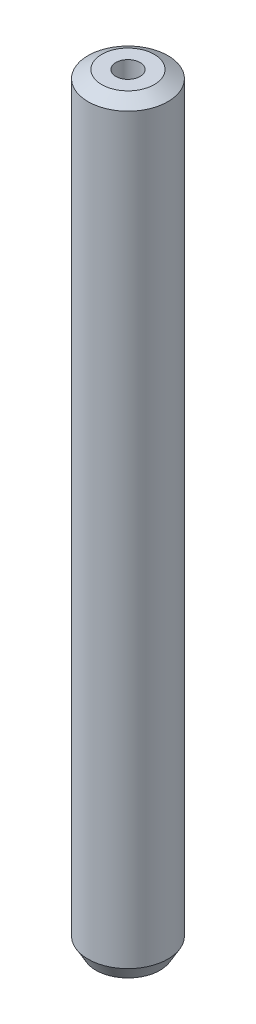
from build123d import *
from OCP.BRepFilletAPI import BRepFilletAPI_MakeChamfer

# Parameters (mm, degrees)
SKETCH1_R           = 27.5
BOSS_EXTRUDE1_DEPTH = 526.149621223
SKETCH2_R           = 8.356343826
CUT_EXTRUDE1_DEPTH  = 528.584992122
CHAMFER1_SIZE       = 5.446793177
CHAMFER1_SIZE2      = 9.434122521


with BuildPart() as part:
    # Sketch1 → Boss-Extrude1 (new body)
    with BuildSketch(Plane(origin=(0, 0, 0), x_dir=(1, 0, 0), z_dir=(0, 1, 0))):
        Circle(SKETCH1_R)
    extrude(amount=BOSS_EXTRUDE1_DEPTH)

    # Sketch2 → Cut-Extrude1 (cut, through all)
    with BuildSketch(Plane(origin=(0, 0, 0), x_dir=(1, 0, 0), z_dir=(0, 1, 0))):
        Circle(SKETCH2_R)
    extrude(amount=CUT_EXTRUDE1_DEPTH, mode=Mode.SUBTRACT)

    # Chamfer1: one chamfer whose edges measure the first distance from different faces: ONE call of the kernel's chamfer builder (chamfer() names one face for all edges)
    chamfer1_edges_1 = [part.edges().sort_by_distance(p)[0] for p in [
        (-27.5, 526.149621223, 0),
    ]]
    chamfer1_side_1 = [part.faces().sort_by_distance(p)[0] for p in [
        (-27.5, 263.074810611, 0),
    ]]
    chamfer1_edges_2 = [part.edges().sort_by_distance(p)[0] for p in [
        (-27.5, 0, 0),
    ]]
    chamfer1_side_2 = [part.faces().sort_by_distance(p)[0] for p in [
        (-26.722182541, 0, 0),
    ]]
    chamfer1 = BRepFilletAPI_MakeChamfer(part.part.solid().wrapped)
    for e in chamfer1_edges_1:
        chamfer1.Add(CHAMFER1_SIZE, CHAMFER1_SIZE2, e.wrapped, chamfer1_side_1[0].wrapped)  # the first distance lies on this face
    for e in chamfer1_edges_2:
        chamfer1.Add(CHAMFER1_SIZE, CHAMFER1_SIZE2, e.wrapped, chamfer1_side_2[0].wrapped)  # the first distance lies on this face
    add(Compound.cast(chamfer1.Shape()), mode=Mode.REPLACE)


solid = part.part
